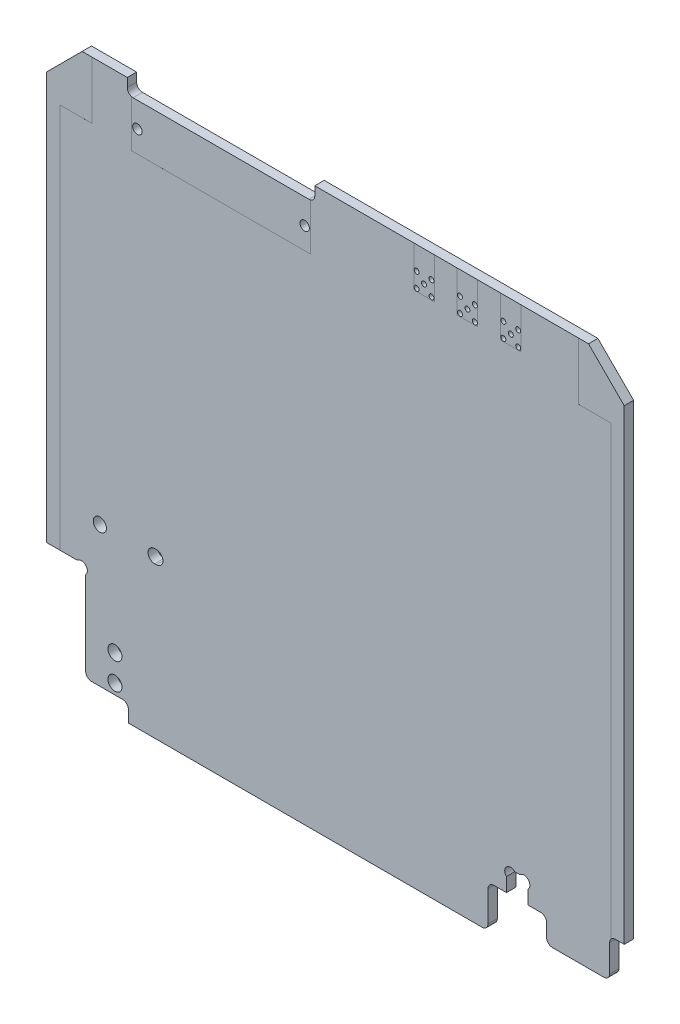
from build123d import *

# Parameters (mm, degrees)
SKETCH1_R           = 0.425
SKETCH1_R_2         = 0.8
BOSS_EXTRUDE1_DEPTH = 1.6
CUT_EXTRUDE1_DEPTH  = 0.0001
CUT_EXTRUDE2_DEPTH  = 0.0001
PARTFOOTPRINTS_W    = 30.48
PARTFOOTPRINTS_H    = 7.989227112
PARTFOOTPRINTS_W_2  = 3.5
PARTFOOTPRINTS_H_2  = 6.95
CUT_EXTRUDE3_DEPTH  = 0.0001
CUT_EXTRUDE4_DEPTH  = 71.235674696
SKETCH3_W           = 7.779754111
SKETCH3_H           = 5.155241991
CUT_EXTRUDE5_DEPTH  = 10
FILLET1_R           = 1
CUT_EXTRUDE6_DEPTH  = 71.235674696
FILLET2_R           = 1
SKETCH5_R           = 1.125
CUT_EXTRUDE7_DEPTH  = 71.235674696
SKETCH6_R           = 1.2
CUT_EXTRUDE8_DEPTH  = 71.235674696


with BuildPart() as part:
    # Sketch1 → Boss-Extrude1 (new body)
    with BuildSketch(Plane(origin=(0, 0, -0.0125), x_dir=(-1, 0, 0), z_dir=(0, 0, -1))):
        with BuildLine():
            Line((35.3, -50), (35.3, -48))
            ThreePointArc((35.3, -48), (35.592893219, -47.292893219), (36.3, -47))
            Line((36.3, -47), (45.8, -47))
            ThreePointArc((45.8, -47), (46.507106781, -46.707106781), (46.8, -46))
            Line((46.8, -46), (46.8, -41.4))
            ThreePointArc((46.8, -41.4), (47.092893219, -40.692893219), (47.8, -40.4))
            Line((47.8, -40.4), (49.3, -40.4))
            Line((49.3, -40.4), (49.3, 39.2))
            Line((49.3, 39.2), (43.2, 45.3))
            Line((43.2, 45.3), (35.500000002, 45.3))
            Line((35.500000002, 45.3), (35.500000002, 43.8))
            ThreePointArc((35.500000002, 43.8), (35.207106783, 43.092893219), (34.500000002, 42.8))
            Line((34.500000002, 42.8), (4.499999998, 42.8))
            ThreePointArc((4.499999998, 42.8), (3.792893217, 43.092893219), (3.499999998, 43.8))
            Line((3.499999998, 43.8), (3.499999998, 45.3))
            Line((3.499999998, 45.3), (-43.2, 45.3))
            Line((-43.2, 45.3), (-49.3, 39.2))
            Line((-49.3, 39.2), (-49.3, -40.4))
            Line((-49.3, -40.4), (-47.8, -40.4))
            ThreePointArc((-47.8, -40.4), (-47.092893219, -40.692893219), (-46.8, -41.4))
            Line((-46.8, -41.4), (-46.8, -46))
            ThreePointArc((-46.8, -46), (-46.507106781, -46.707106781), (-45.8, -47))
            Line((-45.8, -47), (-36.3, -47))
            ThreePointArc((-36.3, -47), (-35.592893219, -47.292893219), (-35.3, -48))
            Line((-35.3, -48), (-35.3, -50))
            Line((-35.3, -50), (35.3, -50))
        make_face()
        with Locations((-21.27, 41.37)):
            Circle(SKETCH1_R, mode=Mode.SUBTRACT)
        with Locations((-23.81, 41.37)):
            Circle(SKETCH1_R, mode=Mode.SUBTRACT)
        with Locations((-22.54, 40.1)):
            Circle(SKETCH1_R, mode=Mode.SUBTRACT)
        with Locations((-13.87, 41.37)):
            Circle(SKETCH1_R, mode=Mode.SUBTRACT)
        with Locations((-23.81, 38.83)):
            Circle(SKETCH1_R, mode=Mode.SUBTRACT)
        with Locations((-16.41, 41.37)):
            Circle(SKETCH1_R, mode=Mode.SUBTRACT)
        with Locations((-15.14, 40.1)):
            Circle(SKETCH1_R, mode=Mode.SUBTRACT)
        with Locations((-21.27, 38.83)):
            Circle(SKETCH1_R, mode=Mode.SUBTRACT)
        with Locations((-28.67, 41.37)):
            Circle(SKETCH1_R, mode=Mode.SUBTRACT)
        with Locations((-31.21, 41.37)):
            Circle(SKETCH1_R, mode=Mode.SUBTRACT)
        with Locations((-16.41, 38.83)):
            Circle(SKETCH1_R, mode=Mode.SUBTRACT)
        with Locations((-29.94, 40.1)):
            Circle(SKETCH1_R, mode=Mode.SUBTRACT)
        with Locations((-31.21, 38.83)):
            Circle(SKETCH1_R, mode=Mode.SUBTRACT)
        with Locations((-28.67, 38.83)):
            Circle(SKETCH1_R, mode=Mode.SUBTRACT)
        with Locations((33.775, 38.54)):
            Circle(SKETCH1_R_2, mode=Mode.SUBTRACT)
        with Locations((5.225, 38.54)):
            Circle(SKETCH1_R_2, mode=Mode.SUBTRACT)
        with Locations((-13.87, 38.83)):
            Circle(SKETCH1_R, mode=Mode.SUBTRACT)
    extrude(amount=-BOSS_EXTRUDE1_DEPTH)

    # thermalContacts_lower → Cut-Extrude1 (cut)
    with BuildSketch(Plane(origin=(0, 0, -0.0125), x_dir=(-1, 0, 0), z_dir=(0, 0, -1))):
        Polygon((47, 35.5), (47, -41.5), (59.827263463, -41.5), (59.827263463, 48.757689229), (41.5, 48.757689229), (41.5, 41.5), (41.5, 35.5), align=None)
        Polygon((-47, 35.5), (-47, -41.5), (-56.192158269, -41.5), (-56.192158269, 47), (-41.5, 47), (-41.5, 41.5), (-41.5, 35.5), align=None)
    extrude(amount=-CUT_EXTRUDE1_DEPTH, mode=Mode.SUBTRACT)

    # thermalContacts_upper → Cut-Extrude2 (cut)
    with BuildSketch(Plane.XY.offset(1.5875)):
        Polygon((-47, 35.5), (-47, -41.5), (-56.192158269, -41.5), (-56.192158269, 47), (-41.5, 47), (-41.5, 41.5), (-41.5, 35.5), align=None)
        Polygon((47, 35.5), (47, -41.5), (59.827263463, -41.5), (59.827263463, 47), (41.5, 47), (41.5, 41.5), (41.5, 35.5), align=None)
    extrude(amount=-CUT_EXTRUDE2_DEPTH, mode=Mode.SUBTRACT)

    # partFootprints → Cut-Extrude3 (cut)
    with BuildSketch(Plane.XY.offset(1.5875)):
        with Locations((-19.5, 38.834613556)):
            Rectangle(PARTFOOTPRINTS_W, PARTFOOTPRINTS_H)
        with Locations((15.14, 41.825)):
            Rectangle(PARTFOOTPRINTS_W_2, PARTFOOTPRINTS_H_2)
        with Locations((22.54, 41.825)):
            Rectangle(PARTFOOTPRINTS_W_2, PARTFOOTPRINTS_H_2)
        with Locations((29.94, 41.825)):
            Rectangle(PARTFOOTPRINTS_W_2, PARTFOOTPRINTS_H_2)
    extrude(amount=-CUT_EXTRUDE3_DEPTH, mode=Mode.SUBTRACT)

    # Sketch2 → Cut-Extrude4 (cut, through all)
    with BuildSketch(Plane.XY.offset(1.5875)):
        with BuildLine():
            Line((29.2, -42.8), (29.2, -40.414213562))
            ThreePointArc((29.2, -40.414213562), (29.2, -39), (30.614213562, -39))
            Line((30.614213562, -39), (31.485786438, -39))
            ThreePointArc((31.485786438, -39), (32.9, -39), (32.9, -40.414213562))
            Line((32.9, -40.414213562), (32.9, -42.8))
            Line((32.9, -42.8), (36.05, -42.8))
            Line((36.05, -42.8), (36.05, -50))
            Line((36.05, -50), (26.05, -50))
            Line((26.05, -50), (26.05, -42.8))
            Line((26.05, -42.8), (29.2, -42.8))
        make_face()
    extrude(amount=-CUT_EXTRUDE4_DEPTH, mode=Mode.SUBTRACT)

    # Sketch3 → Cut-Extrude5 (cut)
    with BuildSketch(Plane.XY.offset(1.5875)):
        with Locations((35.630924609, -49.577620995)):
            Rectangle(SKETCH3_W, SKETCH3_H)
    extrude(amount=-CUT_EXTRUDE5_DEPTH, mode=Mode.SUBTRACT)

    # Fillet1
    fillet1_edges = [part.edges().sort_by_distance(p)[0] for p in [
        (36.05, -42.8, 0.7875),
        (26.05, -42.8, 0.7875),
        (36.05, -47, 0.7875),
        (26.05, -50, 0.7875),
    ]]
    fillet(fillet1_edges, radius=FILLET1_R)

    # Sketch4 → Cut-Extrude6 (cut, through all)
    with BuildSketch(Plane.XY.offset(1.5875)):
        with BuildLine():
            Line((-51.38081647, -30.3), (-44.014213562, -30.3))
            ThreePointArc((-44.014213562, -30.3), (-42.6, -30.3), (-42.6, -31.714213562))
            Line((-42.6, -31.714213562), (-42.6, -47))
            Line((-42.6, -47), (-51.38081647, -47))
            Line((-51.38081647, -47), (-51.38081647, -30.3))
        make_face()
    extrude(amount=-CUT_EXTRUDE6_DEPTH, mode=Mode.SUBTRACT)

    # Fillet2
    fillet2_edges = [part.edges().sort_by_distance(p)[0] for p in [
        (-42.6, -47, 0.7875),
    ]]
    fillet(fillet2_edges, radius=FILLET2_R)

    # Sketch5 → Cut-Extrude7 (cut, through all)
    with BuildSketch(Plane.XY.offset(1.5875)):
        with Locations((-40.175, -23.1)):
            Circle(SKETCH5_R)
        with BuildLine():
            Line((-30.525, -24.225), (-30.825, -24.225))
            ThreePointArc((-30.825, -24.225), (-31.95, -23.1), (-30.825, -21.975))
            Line((-30.825, -21.975), (-30.525, -21.975))
            ThreePointArc((-30.525, -21.975), (-29.4, -23.1), (-30.525, -24.225))
        make_face()
    extrude(amount=-CUT_EXTRUDE7_DEPTH, mode=Mode.SUBTRACT)

    # Sketch6 → Cut-Extrude8 (cut, through all)
    with BuildSketch(Plane.XY.offset(1.5875)):
        with Locations((-37.6, -40.75)):
            Circle(SKETCH6_R)
        with Locations((-37.6, -45.25)):
            Circle(SKETCH6_R)
    extrude(amount=-CUT_EXTRUDE8_DEPTH, mode=Mode.SUBTRACT)


solid = part.part
